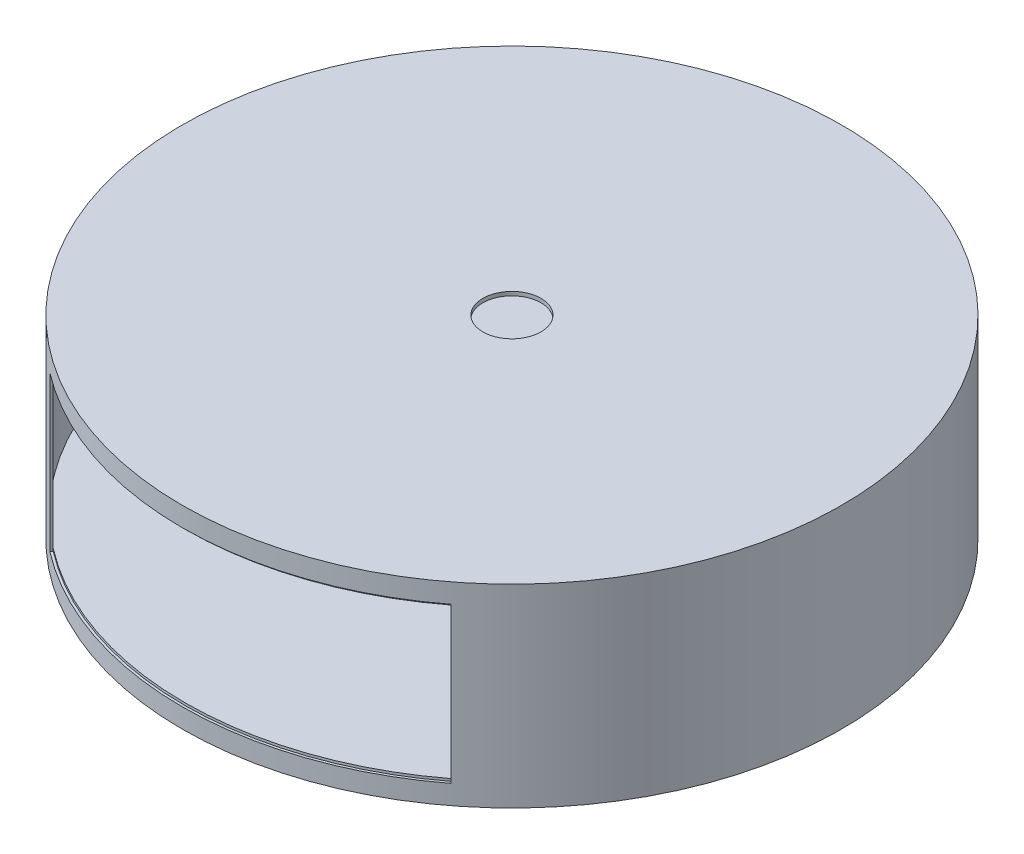
from build123d import *

# Parameters (mm, degrees)
SKETCH1_R           = 215.9
BOSS_EXTRUDE1_DEPTH = 63.5
SKETCH2_R           = 214.3125
CUT_EXTRUDE1_DEPTH  = 49.2125
SKETCH3_W           = 1.5875
SKETCH3_H           = 101.6
CUT_REVOLVE1_ANGLE  = 75
SKETCH4_R           = 19.05
CUT_EXTRUDE2_DEPTH  = 2.54


with BuildPart() as part:
    # Sketch1 → Boss-Extrude1 (new, symmetric)
    with BuildSketch(Plane(origin=(0, 0, 0), x_dir=(1, 0, 0), z_dir=(0, 1, 0))):
        Circle(SKETCH1_R)
    extrude(amount=BOSS_EXTRUDE1_DEPTH, both=True)

    # Sketch2 → Cut-Extrude1 (cut, symmetric)
    with BuildSketch(Plane(origin=(0, 0, 0), x_dir=(1, 0, 0), z_dir=(0, 1, 0))):
        Circle(SKETCH2_R)
    extrude(amount=CUT_EXTRUDE1_DEPTH, both=True, mode=Mode.SUBTRACT)

    # Sketch3 → Cut-Revolve1 (revolve, symmetric, cut)
    with BuildSketch(Plane(origin=(0, 0, 0), x_dir=(0, 0, -1), z_dir=(1, 0, 0))) as cut_revolve1_sk:
        with Locations((-215.10625, 0)):
            Rectangle(SKETCH3_W, SKETCH3_H)
    revolve(axis=Axis((0, 0, 0), (0, 1, 0)), revolution_arc=CUT_REVOLVE1_ANGLE / 2, mode=Mode.SUBTRACT)
    revolve(cut_revolve1_sk.sketch, axis=Axis((0, 0, 0), (0, -1, 0)), revolution_arc=CUT_REVOLVE1_ANGLE / 2, mode=Mode.SUBTRACT)

    # Sketch4 → Cut-Extrude2 (cut)
    with BuildSketch(Plane(origin=(0, 63.5, 0), x_dir=(1, 0, 0), z_dir=(0, 1, 0))):
        Circle(SKETCH4_R)
    extrude(amount=-CUT_EXTRUDE2_DEPTH, mode=Mode.SUBTRACT)


solid = part.part
